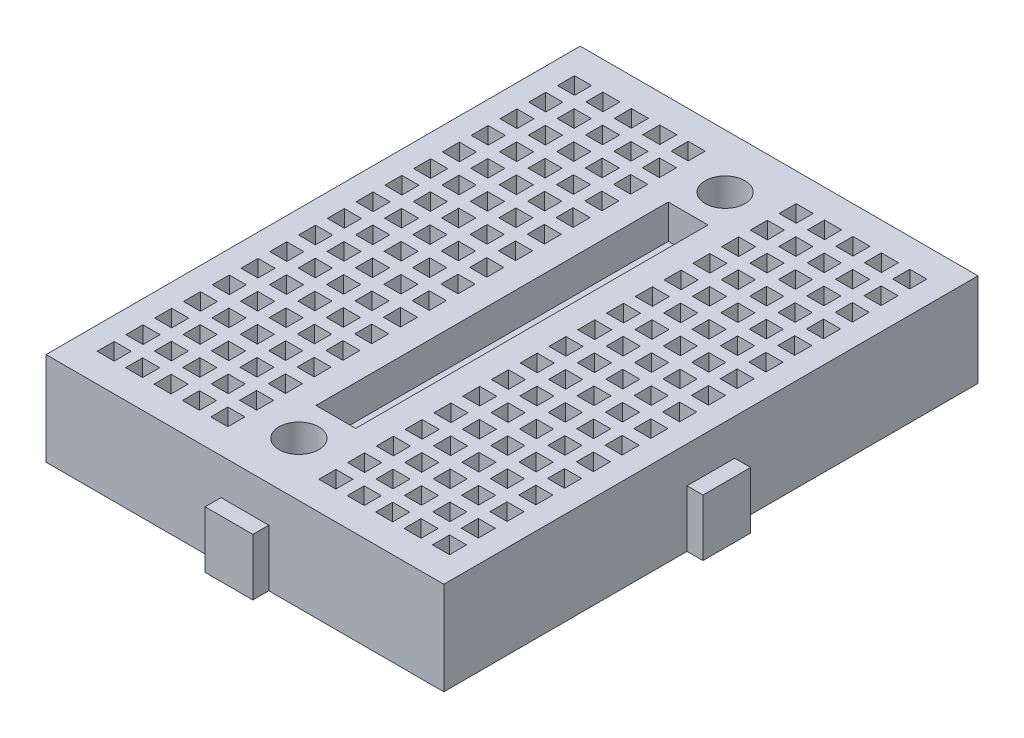
from build123d import *
from build123d.topology import SkipClean

# Parameters (mm, degrees)
SKETCH2_W           = 17.5
SKETCH2_H           = 47
BOSS_EXTRUDE1_DEPTH = 5.2
SKETCH3_W           = 1.5
SKETCH3_H           = 1.5
BOSS_EXTRUDE2_DEPTH = 3
SKETCH4_R           = 1
CUT_EXTRUDE1_DEPTH  = 30.758024128
SKETCH7_W           = 4.2
SKETCH7_H           = 5
BOSS_EXTRUDE4_DEPTH = 1.4
SKETCH8_W           = 4.2
SKETCH8_H           = 5
CUT_EXTRUDE2_DEPTH  = 1.7
SKETCH9_W           = 4.2
SKETCH9_H           = 5
BOSS_EXTRUDE5_DEPTH = 1.4
SKETCH10_W          = 4.2
SKETCH10_H          = 5
CUT_EXTRUDE3_DEPTH  = 1.7


with BuildPart() as part:
    # Sketch2 → Boss-Extrude1 (new body)
    with BuildSketch(Plane(origin=(0, 0, 0), x_dir=(1, 0, 0), z_dir=(0, 1, 0))):
        with Locations((-8.75, 0)):
            Rectangle(SKETCH2_W, SKETCH2_H)
    boss_extrude1 = extrude(amount=BOSS_EXTRUDE1_DEPTH)

    # Sketch3 → Boss-Extrude2 (add)
    with BuildSketch(Plane(origin=(0, 5.2, 0), x_dir=(1, 0, 0), z_dir=(0, 1, 0))):
        with BuildLine():
            Line((0, -17), (0, -15.5))
            Line((0, -15.5), (-1.75, -15.5))
            Line((-1.75, -15.5), (-1.75, 15.5))
            Line((-1.75, 15.5), (0, 15.5))
            Line((0, 15.5), (0, 17))
            ThreePointArc((0, 17), (-1.75, 18.75), (0, 20.5))
            Line((0, 20.5), (0, 23.5))
            Line((0, 23.5), (-17.5, 23.5))
            Line((-17.5, 23.5), (-17.5, -23.5))
            Line((-17.5, -23.5), (0, -23.5))
            Line((0, -23.5), (0, -20.5))
            ThreePointArc((0, -20.5), (-1.75, -18.75), (0, -17))
        make_face()
        with Locations((-14.75, -20.25)):
            Rectangle(SKETCH3_W, SKETCH3_H, mode=Mode.SUBTRACT)
        with Locations((-14.75, -17.71875)):
            Rectangle(SKETCH3_W, SKETCH3_H, mode=Mode.SUBTRACT)
        with Locations((-14.75, -15.1875)):
            Rectangle(SKETCH3_W, SKETCH3_H, mode=Mode.SUBTRACT)
        with Locations((-14.75, -12.65625)):
            Rectangle(SKETCH3_W, SKETCH3_H, mode=Mode.SUBTRACT)
        with Locations((-12.25, -20.25)):
            Rectangle(SKETCH3_W, SKETCH3_H, mode=Mode.SUBTRACT)
        with Locations((-12.25, -17.71875)):
            Rectangle(SKETCH3_W, SKETCH3_H, mode=Mode.SUBTRACT)
        with Locations((-9.75, -20.25)):
            Rectangle(SKETCH3_W, SKETCH3_H, mode=Mode.SUBTRACT)
        with Locations((-9.75, -17.71875)):
            Rectangle(SKETCH3_W, SKETCH3_H, mode=Mode.SUBTRACT)
        with Locations((-12.25, -15.1875)):
            Rectangle(SKETCH3_W, SKETCH3_H, mode=Mode.SUBTRACT)
        with Locations((-12.25, -12.65625)):
            Rectangle(SKETCH3_W, SKETCH3_H, mode=Mode.SUBTRACT)
        with Locations((-9.75, -15.1875)):
            Rectangle(SKETCH3_W, SKETCH3_H, mode=Mode.SUBTRACT)
        with Locations((-9.75, -12.65625)):
            Rectangle(SKETCH3_W, SKETCH3_H, mode=Mode.SUBTRACT)
        with Locations((-14.75, -10.125)):
            Rectangle(SKETCH3_W, SKETCH3_H, mode=Mode.SUBTRACT)
        with Locations((-14.75, -7.59375)):
            Rectangle(SKETCH3_W, SKETCH3_H, mode=Mode.SUBTRACT)
        with Locations((-14.75, -5.0625)):
            Rectangle(SKETCH3_W, SKETCH3_H, mode=Mode.SUBTRACT)
        with Locations((-14.75, -2.53125)):
            Rectangle(SKETCH3_W, SKETCH3_H, mode=Mode.SUBTRACT)
        with Locations((-12.25, -10.125)):
            Rectangle(SKETCH3_W, SKETCH3_H, mode=Mode.SUBTRACT)
        with Locations((-12.25, -7.59375)):
            Rectangle(SKETCH3_W, SKETCH3_H, mode=Mode.SUBTRACT)
        with Locations((-9.75, -10.125)):
            Rectangle(SKETCH3_W, SKETCH3_H, mode=Mode.SUBTRACT)
        with Locations((-9.75, -7.59375)):
            Rectangle(SKETCH3_W, SKETCH3_H, mode=Mode.SUBTRACT)
        with Locations((-12.25, -5.0625)):
            Rectangle(SKETCH3_W, SKETCH3_H, mode=Mode.SUBTRACT)
        with Locations((-12.25, -2.53125)):
            Rectangle(SKETCH3_W, SKETCH3_H, mode=Mode.SUBTRACT)
        with Locations((-9.75, -5.0625)):
            Rectangle(SKETCH3_W, SKETCH3_H, mode=Mode.SUBTRACT)
        with Locations((-9.75, -2.53125)):
            Rectangle(SKETCH3_W, SKETCH3_H, mode=Mode.SUBTRACT)
        with Locations((-7.25, -20.25)):
            Rectangle(SKETCH3_W, SKETCH3_H, mode=Mode.SUBTRACT)
        with Locations((-7.25, -17.71875)):
            Rectangle(SKETCH3_W, SKETCH3_H, mode=Mode.SUBTRACT)
        with Locations((-4.75, -20.25)):
            Rectangle(SKETCH3_W, SKETCH3_H, mode=Mode.SUBTRACT)
        with Locations((-4.75, -17.71875)):
            Rectangle(SKETCH3_W, SKETCH3_H, mode=Mode.SUBTRACT)
        with Locations((-7.25, -15.1875)):
            Rectangle(SKETCH3_W, SKETCH3_H, mode=Mode.SUBTRACT)
        with Locations((-7.25, -12.65625)):
            Rectangle(SKETCH3_W, SKETCH3_H, mode=Mode.SUBTRACT)
        with Locations((-4.75, -15.1875)):
            Rectangle(SKETCH3_W, SKETCH3_H, mode=Mode.SUBTRACT)
        with Locations((-4.75, -12.65625)):
            Rectangle(SKETCH3_W, SKETCH3_H, mode=Mode.SUBTRACT)
        with Locations((-7.25, -10.125)):
            Rectangle(SKETCH3_W, SKETCH3_H, mode=Mode.SUBTRACT)
        with Locations((-7.25, -7.59375)):
            Rectangle(SKETCH3_W, SKETCH3_H, mode=Mode.SUBTRACT)
        with Locations((-4.75, -10.125)):
            Rectangle(SKETCH3_W, SKETCH3_H, mode=Mode.SUBTRACT)
        with Locations((-4.75, -7.59375)):
            Rectangle(SKETCH3_W, SKETCH3_H, mode=Mode.SUBTRACT)
        with Locations((-7.25, -5.0625)):
            Rectangle(SKETCH3_W, SKETCH3_H, mode=Mode.SUBTRACT)
        with Locations((-7.25, -2.53125)):
            Rectangle(SKETCH3_W, SKETCH3_H, mode=Mode.SUBTRACT)
        with Locations((-4.75, -5.0625)):
            Rectangle(SKETCH3_W, SKETCH3_H, mode=Mode.SUBTRACT)
        with Locations((-4.75, -2.53125)):
            Rectangle(SKETCH3_W, SKETCH3_H, mode=Mode.SUBTRACT)
        with Locations((-14.75, 0)):
            Rectangle(SKETCH3_W, SKETCH3_H, mode=Mode.SUBTRACT)
        with Locations((-14.75, 2.53125)):
            Rectangle(SKETCH3_W, SKETCH3_H, mode=Mode.SUBTRACT)
        with Locations((-14.75, 5.0625)):
            Rectangle(SKETCH3_W, SKETCH3_H, mode=Mode.SUBTRACT)
        with Locations((-14.75, 7.59375)):
            Rectangle(SKETCH3_W, SKETCH3_H, mode=Mode.SUBTRACT)
        with Locations((-14.75, 10.125)):
            Rectangle(SKETCH3_W, SKETCH3_H, mode=Mode.SUBTRACT)
        with Locations((-12.25, 0)):
            Rectangle(SKETCH3_W, SKETCH3_H, mode=Mode.SUBTRACT)
        with Locations((-12.25, 2.53125)):
            Rectangle(SKETCH3_W, SKETCH3_H, mode=Mode.SUBTRACT)
        with Locations((-12.25, 5.0625)):
            Rectangle(SKETCH3_W, SKETCH3_H, mode=Mode.SUBTRACT)
        with Locations((-9.75, 0)):
            Rectangle(SKETCH3_W, SKETCH3_H, mode=Mode.SUBTRACT)
        with Locations((-9.75, 2.53125)):
            Rectangle(SKETCH3_W, SKETCH3_H, mode=Mode.SUBTRACT)
        with Locations((-9.75, 5.0625)):
            Rectangle(SKETCH3_W, SKETCH3_H, mode=Mode.SUBTRACT)
        with Locations((-12.25, 7.59375)):
            Rectangle(SKETCH3_W, SKETCH3_H, mode=Mode.SUBTRACT)
        with Locations((-12.25, 10.125)):
            Rectangle(SKETCH3_W, SKETCH3_H, mode=Mode.SUBTRACT)
        with Locations((-9.75, 7.59375)):
            Rectangle(SKETCH3_W, SKETCH3_H, mode=Mode.SUBTRACT)
        with Locations((-9.75, 10.125)):
            Rectangle(SKETCH3_W, SKETCH3_H, mode=Mode.SUBTRACT)
        with Locations((-14.75, 12.65625)):
            Rectangle(SKETCH3_W, SKETCH3_H, mode=Mode.SUBTRACT)
        with Locations((-14.75, 15.1875)):
            Rectangle(SKETCH3_W, SKETCH3_H, mode=Mode.SUBTRACT)
        with Locations((-14.75, 17.71875)):
            Rectangle(SKETCH3_W, SKETCH3_H, mode=Mode.SUBTRACT)
        with Locations((-14.75, 20.25)):
            Rectangle(SKETCH3_W, SKETCH3_H, mode=Mode.SUBTRACT)
        with Locations((-12.25, 12.65625)):
            Rectangle(SKETCH3_W, SKETCH3_H, mode=Mode.SUBTRACT)
        with Locations((-12.25, 15.1875)):
            Rectangle(SKETCH3_W, SKETCH3_H, mode=Mode.SUBTRACT)
        with Locations((-9.75, 12.65625)):
            Rectangle(SKETCH3_W, SKETCH3_H, mode=Mode.SUBTRACT)
        with Locations((-9.75, 15.1875)):
            Rectangle(SKETCH3_W, SKETCH3_H, mode=Mode.SUBTRACT)
        with Locations((-12.25, 17.71875)):
            Rectangle(SKETCH3_W, SKETCH3_H, mode=Mode.SUBTRACT)
        with Locations((-12.25, 20.25)):
            Rectangle(SKETCH3_W, SKETCH3_H, mode=Mode.SUBTRACT)
        with Locations((-9.75, 17.71875)):
            Rectangle(SKETCH3_W, SKETCH3_H, mode=Mode.SUBTRACT)
        with Locations((-9.75, 20.25)):
            Rectangle(SKETCH3_W, SKETCH3_H, mode=Mode.SUBTRACT)
        with Locations((-7.25, 0)):
            Rectangle(SKETCH3_W, SKETCH3_H, mode=Mode.SUBTRACT)
        with Locations((-7.25, 2.53125)):
            Rectangle(SKETCH3_W, SKETCH3_H, mode=Mode.SUBTRACT)
        with Locations((-7.25, 5.0625)):
            Rectangle(SKETCH3_W, SKETCH3_H, mode=Mode.SUBTRACT)
        with Locations((-4.75, 0)):
            Rectangle(SKETCH3_W, SKETCH3_H, mode=Mode.SUBTRACT)
        with Locations((-4.75, 2.53125)):
            Rectangle(SKETCH3_W, SKETCH3_H, mode=Mode.SUBTRACT)
        with Locations((-4.75, 5.0625)):
            Rectangle(SKETCH3_W, SKETCH3_H, mode=Mode.SUBTRACT)
        with Locations((-7.25, 7.59375)):
            Rectangle(SKETCH3_W, SKETCH3_H, mode=Mode.SUBTRACT)
        with Locations((-7.25, 10.125)):
            Rectangle(SKETCH3_W, SKETCH3_H, mode=Mode.SUBTRACT)
        with Locations((-4.75, 7.59375)):
            Rectangle(SKETCH3_W, SKETCH3_H, mode=Mode.SUBTRACT)
        with Locations((-4.75, 10.125)):
            Rectangle(SKETCH3_W, SKETCH3_H, mode=Mode.SUBTRACT)
        with Locations((-7.25, 12.65625)):
            Rectangle(SKETCH3_W, SKETCH3_H, mode=Mode.SUBTRACT)
        with Locations((-7.25, 15.1875)):
            Rectangle(SKETCH3_W, SKETCH3_H, mode=Mode.SUBTRACT)
        with Locations((-4.75, 12.65625)):
            Rectangle(SKETCH3_W, SKETCH3_H, mode=Mode.SUBTRACT)
        with Locations((-4.75, 15.1875)):
            Rectangle(SKETCH3_W, SKETCH3_H, mode=Mode.SUBTRACT)
        with Locations((-7.25, 17.71875)):
            Rectangle(SKETCH3_W, SKETCH3_H, mode=Mode.SUBTRACT)
        with Locations((-7.25, 20.25)):
            Rectangle(SKETCH3_W, SKETCH3_H, mode=Mode.SUBTRACT)
        with Locations((-4.75, 17.71875)):
            Rectangle(SKETCH3_W, SKETCH3_H, mode=Mode.SUBTRACT)
        with Locations((-4.75, 20.25)):
            Rectangle(SKETCH3_W, SKETCH3_H, mode=Mode.SUBTRACT)
    boss_extrude2 = extrude(amount=BOSS_EXTRUDE2_DEPTH)

    # Mirror1: Boss-Extrude1, Boss-Extrude2 across Right Plane
    with SkipClean():  # the faces are left unmerged after this step: merging them gives an invalid solid
        add(boss_extrude1.mirror(Plane(origin=(0, 0, 0), x_dir=(0, 0, -1), z_dir=(1, 0, 0))))
        add(boss_extrude2.mirror(Plane(origin=(0, 0, 0), x_dir=(0, 0, -1), z_dir=(1, 0, 0))))

    # Sketch4 → Cut-Extrude1 (cut, through all)
    with SkipClean():  # the faces are left unmerged after this step: merging them gives an invalid solid
        with BuildSketch(Plane(origin=(0, 5.2, 0), x_dir=(1, 0, 0), z_dir=(0, 1, 0))):
            with Locations((0, 18.75)):
                Circle(SKETCH4_R)
            with Locations((0, -18.75)):
                Circle(SKETCH4_R)
        extrude(amount=-CUT_EXTRUDE1_DEPTH, mode=Mode.SUBTRACT)

    # Sketch7 → Boss-Extrude4 (add)
    with SkipClean():  # the faces are left unmerged after this step: merging them gives an invalid solid
        with BuildSketch(Plane.XY.offset(23.5)):
            with Locations((0, 2.5)):
                Rectangle(SKETCH7_W, SKETCH7_H)
        extrude(amount=BOSS_EXTRUDE4_DEPTH)

    # Sketch8 → Cut-Extrude2 (cut)
    with SkipClean():  # the faces are left unmerged after this step: merging them gives an invalid solid
        with BuildSketch(Plane(origin=(0, 0, -23.5), x_dir=(-1, 0, 0), z_dir=(0, 0, -1))):
            with Locations((0, 2.5)):
                Rectangle(SKETCH8_W, SKETCH8_H)
        extrude(amount=-CUT_EXTRUDE2_DEPTH, mode=Mode.SUBTRACT)

    # Sketch9 → Boss-Extrude5 (add)
    with SkipClean():  # the faces are left unmerged after this step: merging them gives an invalid solid
        with BuildSketch(Plane(origin=(17.5, 0, 0), x_dir=(0, 0, -1), z_dir=(1, 0, 0))):
            with Locations((0, 2.5)):
                Rectangle(SKETCH9_W, SKETCH9_H)
        extrude(amount=BOSS_EXTRUDE5_DEPTH)

    # Sketch10 → Cut-Extrude3 (cut)
    with SkipClean():  # the faces are left unmerged after this step: merging them gives an invalid solid
        with BuildSketch(Plane.ZY.offset(17.5)):
            with Locations((0, 2.5)):
                Rectangle(SKETCH10_W, SKETCH10_H)
        extrude(amount=-CUT_EXTRUDE3_DEPTH, mode=Mode.SUBTRACT)


solid = part.part
